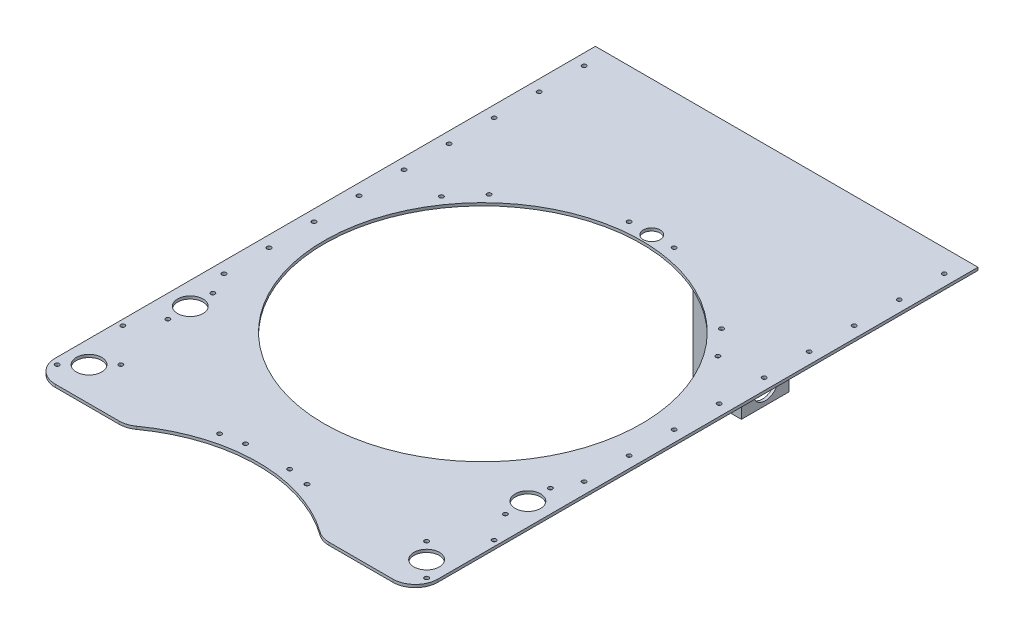
from build123d import *

# Parameters (mm, degrees)
SKETCH1_W           = 431.8
SKETCH1_H           = 685.8
BOSS_EXTRUDE1_DEPTH = 3.175
SKETCH2_R           = 14.3129
SKETCH2_R_2         = 2.38125
CUT_EXTRUDE1_DEPTH  = 406.22006444
SKETCH3_W           = 54.61
SKETCH3_H           = 53.975
BOSS_EXTRUDE2_DEPTH = 203.2
SKETCH4_W           = 48.26
SKETCH4_H           = 47.625
CUT_EXTRUDE2_DEPTH  = 203.2
SKETCH5_R           = 14.2875
CUT_EXTRUDE3_DEPTH  = 203.2
SKETCH6_R           = 179.07
CUT_EXTRUDE4_DEPTH  = 455.734934467
SKETCH8_R           = 9.525
SKETCH8_R_2         = 2.38125
CUT_EXTRUDE6_DEPTH  = 455.734934467
FILLET2_R           = 25.4
SKETCH11_R          = 2.38125
CUT_EXTRUDE9_DEPTH  = 455.734934467
SKETCH13_R          = 2.38125
SKETCH13_R_2        = 2.466421692
SKETCH13_R_3        = 2.307769972
CUT_EXTRUDE10_DEPTH = 455.734934467
SKETCH14_R          = 2.38125
CUT_EXTRUDE11_DEPTH = 455.734934467
SKETCH16_W          = 431.8
SKETCH16_H          = 50.8
CUT_EXTRUDE13_DEPTH = 455.734934467
SKETCH17_R          = 177.8
SKETCH17_R_2        = 2.38125
CUT_EXTRUDE14_DEPTH = 454.302834758
FILLET3_R           = 25.4


with BuildPart() as part:
    # Sketch1 → Boss-Extrude1 (new body)
    with BuildSketch(Plane(origin=(0, 0, 0), x_dir=(1, 0, 0), z_dir=(0, 1, 0))):
        Rectangle(SKETCH1_W, SKETCH1_H)
    extrude(amount=BOSS_EXTRUDE1_DEPTH)

    # Sketch2 → Cut-Extrude1 (cut, through all)
    with BuildSketch(Plane(origin=(0, 3.175, 0), x_dir=(1, 0, 0), z_dir=(0, 1, 0))):
        with Locations((-190.5, -304.8)):
            Circle(SKETCH2_R)
        with Locations((-190.5, -190.5)):
            Circle(SKETCH2_R)
        with Locations((190.5, -190.5)):
            Circle(SKETCH2_R)
        with Locations((190.5, -215.9)):
            Circle(SKETCH2_R_2)
        with Locations((190.5, -165.1)):
            Circle(SKETCH2_R_2)
        with Locations((-190.5, -215.9)):
            Circle(SKETCH2_R_2)
        with Locations((-190.5, -165.1)):
            Circle(SKETCH2_R_2)
        with Locations((-208.460512242, -322.760512242)):
            Circle(SKETCH2_R_2)
        with Locations((-172.539487758, -286.839487758)):
            Circle(SKETCH2_R_2)
        with Locations((172.539487758, -286.839487758)):
            Circle(SKETCH2_R_2)
        with Locations((208.460512242, -322.760512242)):
            Circle(SKETCH2_R_2)
        with Locations((190.5, -304.8)):
            Circle(SKETCH2_R)
    extrude(amount=-CUT_EXTRUDE1_DEPTH, mode=Mode.SUBTRACT)

    # Sketch3 → Boss-Extrude2 (add)
    with BuildSketch(Plane(origin=(0, 0, 0), x_dir=(-1, 0, 0), z_dir=(0, -1, 0))):
        with Locations((2.565647285, 243.220856884)):
            Rectangle(SKETCH3_W, SKETCH3_H)
    extrude(amount=BOSS_EXTRUDE2_DEPTH)

    # Sketch4 → Cut-Extrude2 (cut)
    with BuildSketch(Plane(origin=(0, -203.2, 0), x_dir=(-1, 0, 0), z_dir=(0, -1, 0))):
        with Locations((2.565647285, 243.220856884)):
            Rectangle(SKETCH4_W, SKETCH4_H)
    extrude(amount=-CUT_EXTRUDE2_DEPTH, mode=Mode.SUBTRACT)

    # Sketch5 → Cut-Extrude3 (cut)
    with BuildSketch(Plane.ZY.offset(29.870647285)):
        with Locations((-243.220856884, -184.15)):
            Circle(SKETCH5_R)
    extrude(amount=-CUT_EXTRUDE3_DEPTH, mode=Mode.SUBTRACT)

    # Sketch6 → Cut-Extrude4 (cut, through all)
    with BuildSketch(Plane(origin=(0, 3.175, 0), x_dir=(1, 0, 0), z_dir=(0, 1, 0))):
        with Locations((0, -50.8)):
            Circle(SKETCH6_R)
    extrude(amount=-CUT_EXTRUDE4_DEPTH, mode=Mode.SUBTRACT)

    # Sketch8 → Cut-Extrude6 (cut, through all)
    with BuildSketch(Plane(origin=(0, 3.175, 0), x_dir=(1, 0, 0), z_dir=(0, 1, 0))):
        with Locations((0, 139.7)):
            Circle(SKETCH8_R)
        with Locations((25.4, 139.7)):
            Circle(SKETCH8_R_2)
        with Locations((-25.4, 139.7)):
            Circle(SKETCH8_R_2)
    extrude(amount=-CUT_EXTRUDE6_DEPTH, mode=Mode.SUBTRACT)

    # Fillet2
    fillet2_edges = [part.edges().sort_by_distance(p)[0] for p in [
        (215.9, 1.5875, 342.9),
        (-215.9, 1.5875, 342.9),
    ]]
    fillet(fillet2_edges, radius=FILLET2_R)

    # Sketch11 → Cut-Extrude9 (cut, through all)
    with BuildSketch(Plane(origin=(0, 3.175, 0), x_dir=(1, 0, 0), z_dir=(0, 1, 0))):
        with Locations((156.048464437, 58.466311125)):
            Circle(SKETCH11_R)
        with Locations((131.183773775, 87.334237241)):
            Circle(SKETCH11_R)
        with Locations((-131.183773775, 87.334237241)):
            Circle(SKETCH11_R)
        with Locations((-156.048464437, 58.466311125)):
            Circle(SKETCH11_R)
    extrude(amount=-CUT_EXTRUDE9_DEPTH, mode=Mode.SUBTRACT)

    # Sketch13 → Cut-Extrude10 (cut, through all)
    with BuildSketch(Plane(origin=(0, 3.175, 0), x_dir=(1, 0, 0), z_dir=(0, 1, 0))):
        with Locations((-203.2, 317.5)):
            Circle(SKETCH13_R)
        with Locations((-203.2, 266.7)):
            Circle(SKETCH13_R)
        with Locations((-203.2, 215.9)):
            Circle(SKETCH13_R)
        with Locations((-203.2, 165.1)):
            Circle(SKETCH13_R)
        with Locations((-203.2, 114.3)):
            Circle(SKETCH13_R)
        with Locations((-203.2, 63.5)):
            Circle(SKETCH13_R)
        with Locations((-203.2, 12.7)):
            Circle(SKETCH13_R)
        with Locations((-203.2, -38.1)):
            Circle(SKETCH13_R)
        with Locations((-203.2, -88.9)):
            Circle(SKETCH13_R)
        with Locations((-203.2, -139.7)):
            Circle(SKETCH13_R)
        with Locations((203.2, -139.7)):
            Circle(SKETCH13_R)
        with Locations((203.2, 12.7)):
            Circle(SKETCH13_R)
        with Locations((203.2, 63.5)):
            Circle(SKETCH13_R)
        with Locations((203.2, 114.3)):
            Circle(SKETCH13_R)
        with Locations((203.2, 165.1)):
            Circle(SKETCH13_R)
        with Locations((203.2, 266.7)):
            Circle(SKETCH13_R)
        with Locations((203.2, 317.5)):
            Circle(SKETCH13_R)
        with Locations((-25.4, -330.2)):
            Circle(SKETCH13_R_2)
        with Locations((-50.8, -330.2)):
            Circle(SKETCH13_R_3)
        with Locations((50.8, -330.2)):
            Circle(SKETCH13_R_3)
        with Locations((25.4, -330.2)):
            Circle(SKETCH13_R_2)
        with Locations((203.2, -88.9)):
            Circle(SKETCH13_R)
        with Locations((203.2, -38.1)):
            Circle(SKETCH13_R)
        with Locations((203.2, 215.9)):
            Circle(SKETCH13_R)
    extrude(amount=-CUT_EXTRUDE10_DEPTH, mode=Mode.SUBTRACT)

    # Sketch14 → Cut-Extrude11 (cut, through all)
    with BuildSketch(Plane(origin=(0, 3.175, 0), x_dir=(1, 0, 0), z_dir=(0, 1, 0))):
        with Locations((209.55, -247.65)):
            Circle(SKETCH14_R)
        with Locations((-209.55, -247.65)):
            Circle(SKETCH14_R)
    extrude(amount=-CUT_EXTRUDE11_DEPTH, mode=Mode.SUBTRACT)

    # Sketch16 → Cut-Extrude13 (cut, through all)
    with BuildSketch(Plane(origin=(0, 3.175, 0), x_dir=(1, 0, 0), z_dir=(0, 1, 0))):
        with Locations((0, 317.5)):
            Rectangle(SKETCH16_W, SKETCH16_H)
    extrude(amount=-CUT_EXTRUDE13_DEPTH, mode=Mode.SUBTRACT)

    # Sketch17 → Cut-Extrude14 (cut, through all)
    with BuildSketch(Plane(origin=(0, 0, 0), x_dir=(-1, 0, 0), z_dir=(0, -1, 0))):
        with Locations((0, -482.6)):
            Circle(SKETCH17_R)
        with Locations((24.865239618, -293.729753908)):
            Circle(SKETCH17_R_2)
        with Locations((49.305028092, -298.591130092)):
            Circle(SKETCH17_R_2)
        with Locations((-24.865239618, -293.729753908)):
            Circle(SKETCH17_R_2)
        with Locations((-49.305028092, -298.591130092)):
            Circle(SKETCH17_R_2)
    extrude(amount=-CUT_EXTRUDE14_DEPTH, mode=Mode.SUBTRACT)

    # Fillet3
    fillet3_edges = [part.edges().sort_by_distance(p)[0] for p in [
        (109.985226281, 1.5875, 342.9),
        (-109.985226281, 1.5875, 342.9),
    ]]
    fillet(fillet3_edges, radius=FILLET3_R)


solid = part.part
